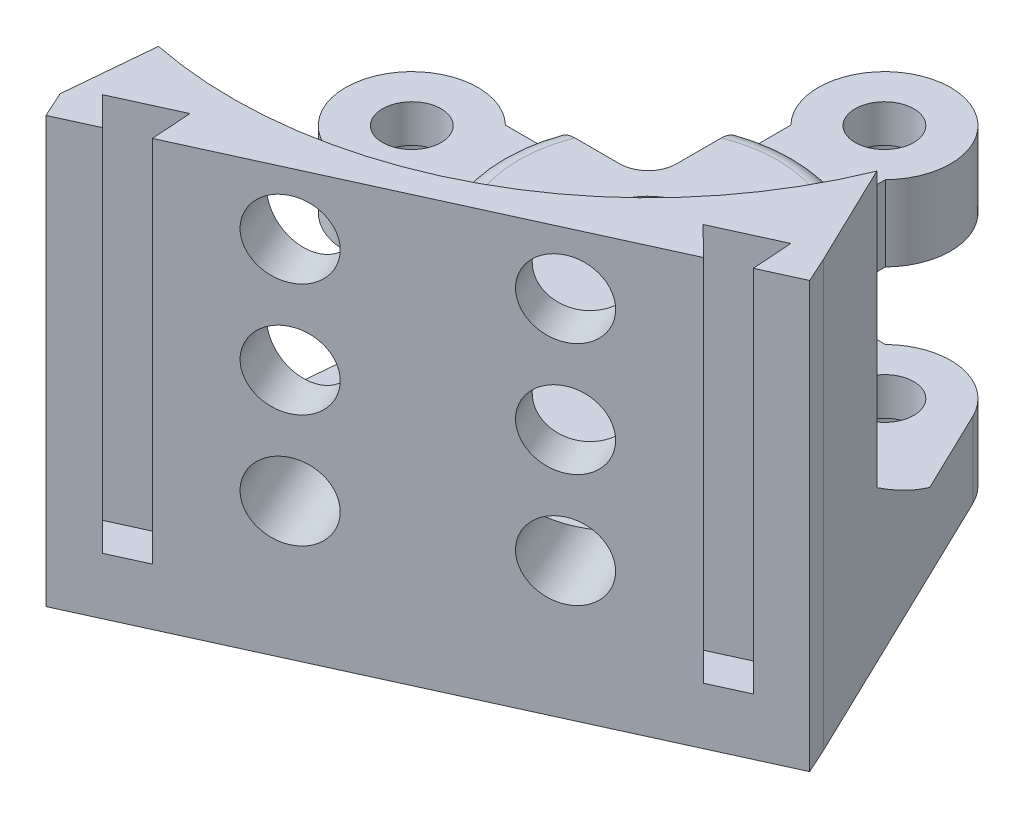
from build123d import *

# Parameters (mm, degrees)
BOSS_EXTRUDE1_DEPTH     = 8
SKETCH2_R               = 7
BOSS_EXTRUDE2_DEPTH     = 8
SKETCH3_R               = 3.1
CUT_EXTRUDE1_DEPTH      = 8
SKETCH4_R               = 5.05
CUT_EXTRUDE4_DEPTH      = 4
BOSS_EXTRUDE3_DEPTH     = 2.5
SKETCH6_W               = 17.6
SKETCH6_H               = 17.6
BOSS_EXTRUDE4_DEPTH     = 16
SKETCH7_R               = 5
CUT_EXTRUDE5_DEPTH      = 26.5
FILLET1_R               = 2
BOSS_EXTRUDE5_START     = -8
BOSS_EXTRUDE5_DEPTH     = 8
SKETCH10_W              = 61
SKETCH10_H              = 45
BOSS_EXTRUDE6_DEPTH     = 3
BOSS_EXTRUDE7_DEPTH     = 37
CUT_EXTRUDE6_DEPTH      = 39
FILLET3_R               = 3
CUT_EXTRUDE7_REACH      = 103.321
CUT_EXTRUDE7_END_RADIUS = 44
SKETCH13_R              = 4
CHAMFER1_SIZE           = 8
FILLET4_R               = 8.8
CUT_EXTRUDE8_REACH      = 93.537
SKETCH14_R              = 2.4


with BuildPart() as part:
    # Sketch1 → Boss-Extrude1 (new body)
    with BuildSketch(Plane(origin=(0, 0, 0), x_dir=(1, 0, 0), z_dir=(0, 1, 0))):
        Polygon((-5, 5), (-5, 25), (5, 25), (5, 5), (25, 5), (25, -5), (5, -5), (5, -25), (-5, -25), (-5, -5), (-25, -5), (-25, 5), align=None)
    extrude(amount=BOSS_EXTRUDE1_DEPTH)

    # Sketch2 → Boss-Extrude2 (add)
    with BuildSketch(Plane(origin=(0, 8, 0), x_dir=(1, 0, 0), z_dir=(0, 1, 0))):
        with Locations((25, 0)):
            Circle(SKETCH2_R)
        with Locations((0, -25)):
            Circle(SKETCH2_R)
        with Locations((-25, 0)):
            Circle(SKETCH2_R)
        with Locations((0, 25)):
            Circle(SKETCH2_R)
    extrude(amount=-BOSS_EXTRUDE2_DEPTH)

    # Sketch3 → Cut-Extrude1 (cut)
    with BuildSketch(Plane(origin=(0, 8, 0), x_dir=(1, 0, 0), z_dir=(0, 1, 0))):
        with Locations(Location((25, 0, 0), (0, 0, 270))):
            Circle(SKETCH3_R)
        with Locations(Location((0, -25, 0), (0, 0, 270))):
            Circle(SKETCH3_R)
        with Locations(Location((-25, 0, 0), (0, 0, 270))):
            Circle(SKETCH3_R)
        with Locations(Location((0, 25, 0), (0, 0, 270))):
            Circle(SKETCH3_R)
    extrude(amount=-CUT_EXTRUDE1_DEPTH, mode=Mode.SUBTRACT)

    # Sketch4 → Cut-Extrude4 (cut)
    with BuildSketch(Plane(origin=(0, 0, 0), x_dir=(1, 0, 0), z_dir=(0, 1, 0))):
        with Locations(Location((25, 0, 0), (0, 0, 270))):
            Circle(SKETCH4_R)
        with Locations(Location((0, -25, 0), (0, 0, 270))):
            Circle(SKETCH4_R)
        with Locations(Location((-25, 0, 0), (0, 0, 270))):
            Circle(SKETCH4_R)
        with Locations(Location((0, 25, 0), (0, 0, 270))):
            Circle(SKETCH4_R)
    extrude(amount=CUT_EXTRUDE4_DEPTH, mode=Mode.SUBTRACT)

    # Sketch5 → Boss-Extrude3 (add)
    with BuildSketch(Plane(origin=(0, 8, 0), x_dir=(1, 0, 0), z_dir=(0, 1, 0))):
        with BuildLine():
            Line((5, 5), (5, 14.882540106))
            ThreePointArc((5, 14.882540106), (0, 15.7), (-5, 14.882540106))
            Line((-5, 14.882540106), (-5, 5))
            Line((-5, 5), (-14.882540106, 5))
            ThreePointArc((-14.882540106, 5), (-15.7, 0), (-14.882540106, -5))
            Line((-14.882540106, -5), (-5, -5))
            Line((-5, -5), (-5, -14.882540106))
            ThreePointArc((-5, -14.882540106), (0, -15.7), (5, -14.882540106))
            Line((5, -14.882540106), (5, -5))
            Line((5, -5), (14.882540106, -5))
            ThreePointArc((14.882540106, -5), (15.7, 0), (14.882540106, 5))
            Line((14.882540106, 5), (5, 5))
        make_face()
    extrude(amount=BOSS_EXTRUDE3_DEPTH)

    # Sketch6 → Boss-Extrude4 (add)
    with BuildSketch(Plane.XZ):
        Rectangle(SKETCH6_W, SKETCH6_H)
    extrude(amount=BOSS_EXTRUDE4_DEPTH)

    # Sketch7 → Cut-Extrude5 (cut)
    with BuildSketch(Plane(origin=(0, 10.5, 0), x_dir=(1, 0, 0), z_dir=(0, 1, 0))):
        with Locations(Location((0, 0, 0), (0, 0, 270))):
            Circle(SKETCH7_R)
    extrude(amount=-CUT_EXTRUDE5_DEPTH, mode=Mode.SUBTRACT)

    # Fillet1
    fillet1_edges = [part.edges().sort_by_distance(p)[0] for p in [
        (0, 10.5, -15.7),
        (-15.7, 10.5, 0),
        (0, 10.5, 15.7),
        (15.7, 10.5, 0),
    ]]
    fillet(fillet1_edges, radius=FILLET1_R)

    # Sketch8 → Boss-Extrude5 (add)
    with BuildSketch(Plane.XZ.offset(BOSS_EXTRUDE5_START)):
        with BuildLine():
            Line((-9.529914461, 52.682356917), (45.988568512, 27.409880814))
            Line((45.988568512, 27.409880814), (31.305222822, -3.040421873))
            ThreePointArc((31.305222822, -3.040421873), (29.081234624, 5.687136709), (20.101020514, 5))
            Line((20.101020514, 5), (8.8, 5))
            Line((8.8, 5), (5, 5))
            Line((5, 5), (5, 8.8))
            Line((5, 8.8), (5, 20.101020514))
            ThreePointArc((5, 20.101020514), (2.351155996, 31.593334929), (-6.971596176, 24.370042252))
            Line((-6.971596176, 24.370042252), (-9.529914461, 52.682356917))
        make_face()
    extrude(amount=BOSS_EXTRUDE5_DEPTH)

    # Sketch10 → Boss-Extrude6 (add)
    with BuildSketch(Plane(origin=(18.229327025, 0, 40.046118866), x_dir=(0.910139065129081, 0, -0.41430288693896705), z_dir=(0.414302886938967, 0, 0.9101390651290809))):
        with Locations((0, 22.5)):
            Rectangle(SKETCH10_W, SKETCH10_H)
    extrude(amount=BOSS_EXTRUDE6_DEPTH)

    # Sketch11 → Boss-Extrude7 (add)
    with BuildSketch(Plane(origin=(0, 8, 0), x_dir=(1, 0, 0), z_dir=(0, 1, 0))):
        with BuildLine():
            Line((-9.529914461, -52.682356917), (18.229326664, -40.04611903))
            ThreePointArc((18.229326664, -40.04611903), (5.02463951, -43.712160754), (-8.667467847, -43.137860414))
            Line((-8.667467847, -43.137860414), (-9.529914461, -52.682356917))
        make_face()
        with BuildLine():
            Line((45.988568512, -27.409880814), (40.761070346, -16.569102097))
            ThreePointArc((40.761070346, -16.569102097), (31.745225088, -30.467042589), (18.229326664, -40.04611903))
            Line((18.229326664, -40.04611903), (45.988568512, -27.409880814))
        make_face()
    extrude(amount=BOSS_EXTRUDE7_DEPTH)

    # Sketch12 → Cut-Extrude6 (cut)
    with BuildSketch(Plane(origin=(0, 45, 0), x_dir=(1, 0, 0), z_dir=(0, 1, 0))):
        Polygon((-4.191380007, -53.548411121), (-7.213800153, -50.529309191), (-0.842826697, -47.629188983), (-0.550823747, -51.891199574), align=None)
        Polygon((39.495295119, -33.661872548), (43.135851379, -32.004661001), (42.843848429, -27.74265041), (36.472874974, -30.642770618), align=None)
    extrude(amount=-CUT_EXTRUDE6_DEPTH, mode=Mode.SUBTRACT)

    # Fillet3
    fillet3_edges = [part.edges().sort_by_distance(p)[0] for p in [
        (-5, 5.25, 5),
        (-5, 5.25, -5),
        (5, 5.25, -5),
    ]]
    fillet(fillet3_edges, radius=FILLET3_R)

    # Cut-Extrude7: up to this cylinder (the profile starts outside it)
    cut_extrude7_end = Plane(origin=(0, 26.5, 0), z_dir=(0, -1, 0)) * Cylinder(CUT_EXTRUDE7_END_RADIUS, 319.642, mode=Mode.PRIVATE)
    # Sketch13 → Cut-Extrude7 (cut, up to the surface)
    with BuildSketch(Plane(origin=(19.472235686, 0, 42.776536061), x_dir=(0.9101390651290809, 0, -0.4143028869389672), z_dir=(0.4143028869389672, 0, 0.910139065129081)), mode=Mode.PRIVATE) as cut_extrude7_sk1:
        with Locations((-11, 38.5)):
            Circle(SKETCH13_R)
    cut_extrude7_tool1 = extrude(cut_extrude7_sk1.sketch, amount=-CUT_EXTRUDE7_REACH, mode=Mode.PRIVATE) - cut_extrude7_end
    add(cut_extrude7_tool1.solids().sort_by_distance((9.460706, 38.5, 47.333868))[0], mode=Mode.SUBTRACT)
    # Sketch13 → Cut-Extrude7 (cut, up to the surface)
    with BuildSketch(Plane(origin=(19.472235686, 0, 42.776536061), x_dir=(0.9101390651290809, 0, -0.4143028869389672), z_dir=(0.4143028869389672, 0, 0.910139065129081)), mode=Mode.PRIVATE) as cut_extrude7_sk2:
        with Locations((-11, 26.5)):
            Circle(SKETCH13_R)
    cut_extrude7_tool2 = extrude(cut_extrude7_sk2.sketch, amount=-CUT_EXTRUDE7_REACH, mode=Mode.PRIVATE) - cut_extrude7_end
    add(cut_extrude7_tool2.solids().sort_by_distance((9.460706, 26.5, 47.333868))[0], mode=Mode.SUBTRACT)
    # Sketch13 → Cut-Extrude7 (cut, up to the surface)
    with BuildSketch(Plane(origin=(19.472235686, 0, 42.776536061), x_dir=(0.9101390651290809, 0, -0.4143028869389672), z_dir=(0.4143028869389672, 0, 0.910139065129081)), mode=Mode.PRIVATE) as cut_extrude7_sk3:
        with Locations((-11, 14.5)):
            Circle(SKETCH13_R)
    cut_extrude7_tool3 = extrude(cut_extrude7_sk3.sketch, amount=-CUT_EXTRUDE7_REACH, mode=Mode.PRIVATE) - cut_extrude7_end
    add(cut_extrude7_tool3.solids().sort_by_distance((9.460706, 14.5, 47.333868))[0], mode=Mode.SUBTRACT)
    # Sketch13 → Cut-Extrude7 (cut, up to the surface)
    with BuildSketch(Plane(origin=(19.472235686, 0, 42.776536061), x_dir=(0.9101390651290809, 0, -0.4143028869389672), z_dir=(0.4143028869389672, 0, 0.910139065129081)), mode=Mode.PRIVATE) as cut_extrude7_sk4:
        with Locations((11, 14.5)):
            Circle(SKETCH13_R)
    cut_extrude7_tool4 = extrude(cut_extrude7_sk4.sketch, amount=-CUT_EXTRUDE7_REACH, mode=Mode.PRIVATE) - cut_extrude7_end
    add(cut_extrude7_tool4.solids().sort_by_distance((29.483765, 14.5, 38.219204))[0], mode=Mode.SUBTRACT)
    # Sketch13 → Cut-Extrude7 (cut, up to the surface)
    with BuildSketch(Plane(origin=(19.472235686, 0, 42.776536061), x_dir=(0.9101390651290809, 0, -0.4143028869389672), z_dir=(0.4143028869389672, 0, 0.910139065129081)), mode=Mode.PRIVATE) as cut_extrude7_sk5:
        with Locations((11, 26.5)):
            Circle(SKETCH13_R)
    cut_extrude7_tool5 = extrude(cut_extrude7_sk5.sketch, amount=-CUT_EXTRUDE7_REACH, mode=Mode.PRIVATE) - cut_extrude7_end
    add(cut_extrude7_tool5.solids().sort_by_distance((29.483765, 26.5, 38.219204))[0], mode=Mode.SUBTRACT)
    # Sketch13 → Cut-Extrude7 (cut, up to the surface)
    with BuildSketch(Plane(origin=(19.472235686, 0, 42.776536061), x_dir=(0.9101390651290809, 0, -0.4143028869389672), z_dir=(0.4143028869389672, 0, 0.910139065129081)), mode=Mode.PRIVATE) as cut_extrude7_sk6:
        with Locations((11, 38.5)):
            Circle(SKETCH13_R)
    cut_extrude7_tool6 = extrude(cut_extrude7_sk6.sketch, amount=-CUT_EXTRUDE7_REACH, mode=Mode.PRIVATE) - cut_extrude7_end
    add(cut_extrude7_tool6.solids().sort_by_distance((29.483765, 38.5, 38.219204))[0], mode=Mode.SUBTRACT)

    # Chamfer1
    # the kernel refuses this chamfer: 8 mm, written as the material it adds along each edge
    with BuildSketch(Plane(origin=(0, 8, 0), x_dir=(-0.6178528100585358, 0, 0.7862937778609028), z_dir=(-0.7862937778609028, 0, -0.6178528100585358))) as chamfer1_piece_1_section:
        Polygon((44 - CHAMFER1_SIZE, 0), (44, CHAMFER1_SIZE), (44, 0), align=None)
    chamfer1_piece_1 = revolve(axis=Axis((0, 8, 0), (0, 1, 0)), revolution_arc=132.836720821, mode=Mode.PRIVATE)
    chamfer1_piece_1 = split(chamfer1_piece_1, bisect_by=Plane(origin=(43.808009207, 11.912275702, 22.88783984), z_dir=(-0.9007461173880659, 0, 0.4343459819203176)), keep=Keep.TOP, mode=Mode.PRIVATE)
    chamfer1_piece_1 = split(chamfer1_piece_1, bisect_by=Plane(origin=(-7.517029949, 11.912275702, 30.406231223), z_dir=(0.9959423108063624, 0, 0.0899939639402728)), keep=Keep.TOP, mode=Mode.PRIVATE)
    chamfer1_piece_1 = chamfer1_piece_1 - Plane(origin=(26.377570165, 14.5, 31.39552598), x_dir=(0.9101390651290809, 0, -0.4143028869389672), z_dir=(0.4143028869389672, 0, 0.9101390651290809)) * Cylinder(4, 176, mode=Mode.PRIVATE)
    chamfer1_piece_1 = chamfer1_piece_1 - Plane(origin=(6.354510732, 14.5, 40.510189492), x_dir=(0.9101390651290809, 0, -0.4143028869389672), z_dir=(0.4143028869389672, 0, 0.9101390651290809)) * Cylinder(4, 176, mode=Mode.PRIVATE)
    add(chamfer1_piece_1)

    # Fillet4
    # the kernel refuses this fillet: 8.8 mm, written as the material it takes off along each edge
    with BuildSketch(Plane(origin=(-8.8, -16, 30.8), x_dir=(0, 1, 0), z_dir=(0, 0, -1)), Plane(origin=(8.8, -16, -30.8), x_dir=(0, 1, 0), z_dir=(0, 0, 1))) as fillet4_piece_1:
        with BuildLine():
            CenterArc((FILLET4_R, FILLET4_R), FILLET4_R, 180, 90)
            Line((0, FILLET4_R), (0, 0))
            Line((0, 0), (FILLET4_R, 0))
        make_face()
    extrude(amount=61.6, mode=Mode.SUBTRACT)

    # Cut-Extrude8: up to this face of the body (flat: up to its plane)
    cut_extrude8_end = Plane(part.part.faces().sort_by_distance((0, -7.192441155, 8.8))[0])
    # Sketch14 → Cut-Extrude8 (cut, up to the picked face)
    with BuildSketch(Plane(origin=(0, 0, -8.8), x_dir=(-1, 0, 0), z_dir=(0, 0, -1)), mode=Mode.PRIVATE) as cut_extrude8_sk1:
        with Locations((0, -7.2)):
            Circle(SKETCH14_R)
    cut_extrude8_tool1 = split(extrude(cut_extrude8_sk1.sketch, amount=-CUT_EXTRUDE8_REACH, mode=Mode.PRIVATE), bisect_by=cut_extrude8_end, keep=Keep.BOTH, mode=Mode.PRIVATE)
    add(cut_extrude8_tool1.solids().sort_by(Axis((0, -7.2, -8.8), (0, 0, 1)))[0], mode=Mode.SUBTRACT)


solid = part.part
